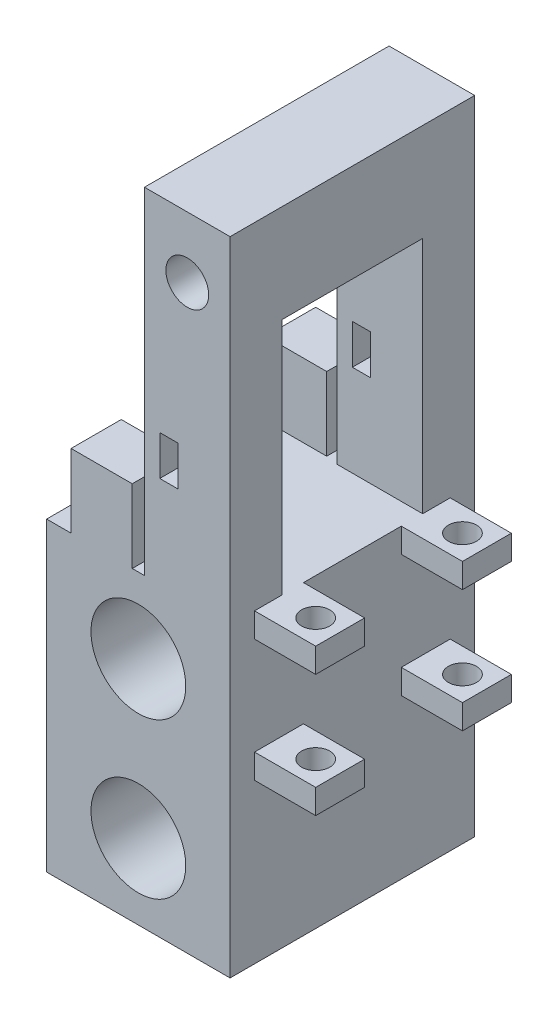
from build123d import *

# Parameters (mm, degrees)
ESQUISSE1_W              = 30
ESQUISSE1_H              = 50
BOSS_EXTRU_1_DEPTH       = 40
BOSS_EXTRU_3_START       = -40
BOSS_EXTRU_3_OUTLINE_R   = 7.75
BOSS_EXTRU_3_DEPTH       = 40
ESQUISSE138_W            = 14
ESQUISSE138_H            = 8.5
BOSS_EXTRU_4_DEPTH       = 55
ESQUISSE145_W            = 8
ESQUISSE145_H            = 4
BOSS_EXTRU_5_DEPTH       = 10
ESQUISSE146_R            = 2.3
ENL_V_MAT_EXTRU_13_DEPTH = 39
ESQUISSE147_W            = 3
ESQUISSE147_H            = 6.5
ENL_V_MAT_EXTRU_14_DEPTH = 40
ESQUISSE150_W            = 10
ESQUISSE150_H            = 8.2
BOSS_EXTRU_6_DEPTH       = 12
ESQUISSE154_W            = 14
ESQUISSE154_H            = 16
BOSS_EXTRU_7_DEPTH       = 23
ESQUISSE152_R            = 3.5
ENL_V_MAT_EXTRU_16_DEPTH = 40


# Read off the part's stored shape, not the designer's step: Boss.-Extru.3
with BuildPart() as part:
    # Esquisse1 → Boss.-Extru.1 (new body)
    with BuildSketch(Plane.XY):
        with Locations((15, 25)):
            Rectangle(ESQUISSE1_W, ESQUISSE1_H)
    extrude(amount=BOSS_EXTRU_1_DEPTH)

    # Boss.-Extru.3 outline → Boss.-Extru.3 (cut)
    with BuildSketch(Plane.XY.offset(40).offset(BOSS_EXTRU_3_START)):
        with Locations((15, 12.3)):
            Circle(BOSS_EXTRU_3_OUTLINE_R)
        with Locations((15, 37.7)):
            Circle(BOSS_EXTRU_3_OUTLINE_R)
    extrude(amount=BOSS_EXTRU_3_DEPTH, mode=Mode.SUBTRACT)

    # Esquisse138 → Boss.-Extru.4 (add)
    with BuildSketch(Plane(origin=(0, 50, 0), x_dir=(1, 0, 0), z_dir=(0, 1, 0))):
        with Locations((23, -35.75)):
            Rectangle(ESQUISSE138_W, ESQUISSE138_H)
        with Locations((23, -4.25)):
            Rectangle(ESQUISSE138_W, ESQUISSE138_H)
    extrude(amount=BOSS_EXTRU_4_DEPTH)

    # Esquisse145 → Boss.-Extru.5 (add)
    with BuildSketch(Plane(origin=(30, 0, 0), x_dir=(0, 0, -1), z_dir=(1, 0, 0))):
        with Locations((-32, 48)):
            Rectangle(ESQUISSE145_W, ESQUISSE145_H)
        with Locations((-8, 48)):
            Rectangle(ESQUISSE145_W, ESQUISSE145_H)
        with Locations((-32, 28)):
            Rectangle(ESQUISSE145_W, ESQUISSE145_H)
        with Locations((-8, 28)):
            Rectangle(ESQUISSE145_W, ESQUISSE145_H)
    extrude(amount=BOSS_EXTRU_5_DEPTH)

    # Esquisse146 → Enlèv. mat.-Extru.13 (cut)
    with BuildSketch(Plane(origin=(0, 50, 0), x_dir=(1, 0, 0), z_dir=(0, 1, 0))):
        with Locations(Location((36, -32, 0), (0, 0, 270))):
            Circle(ESQUISSE146_R)
        with Locations(Location((36, -8, 0), (0, 0, 270))):
            Circle(ESQUISSE146_R)
    extrude(amount=-ENL_V_MAT_EXTRU_13_DEPTH, mode=Mode.SUBTRACT)

    # Esquisse147 → Enlèv. mat.-Extru.14 (cut)
    with BuildSketch(Plane.XY.offset(40)):
        with Locations((20, 68.25)):
            Rectangle(ESQUISSE147_W, ESQUISSE147_H)
    extrude(amount=-ENL_V_MAT_EXTRU_14_DEPTH, mode=Mode.SUBTRACT)

    # Esquisse150 → Boss.-Extru.6 (add)
    with BuildSketch(Plane(origin=(0, 50, 0), x_dir=(1, 0, 0), z_dir=(0, 1, 0))):
        with Locations((9, -4.1)):
            Rectangle(ESQUISSE150_W, ESQUISSE150_H)
        with Locations((9, -35.9)):
            Rectangle(ESQUISSE150_W, ESQUISSE150_H)
    extrude(amount=BOSS_EXTRU_6_DEPTH)

    # Esquisse154 → Boss.-Extru.7 (add)
    with BuildSketch(Plane.XY.offset(8.5)):
        with Locations((23, 97)):
            Rectangle(ESQUISSE154_W, ESQUISSE154_H)
    extrude(amount=BOSS_EXTRU_7_DEPTH)

    # Esquisse152 → Enlèv. mat.-Extru.16 (cut)
    with BuildSketch(Plane.XY.offset(40)):
        with Locations((23, 95)):
            Circle(ESQUISSE152_R)
    extrude(amount=-ENL_V_MAT_EXTRU_16_DEPTH, mode=Mode.SUBTRACT)


solid = part.part
